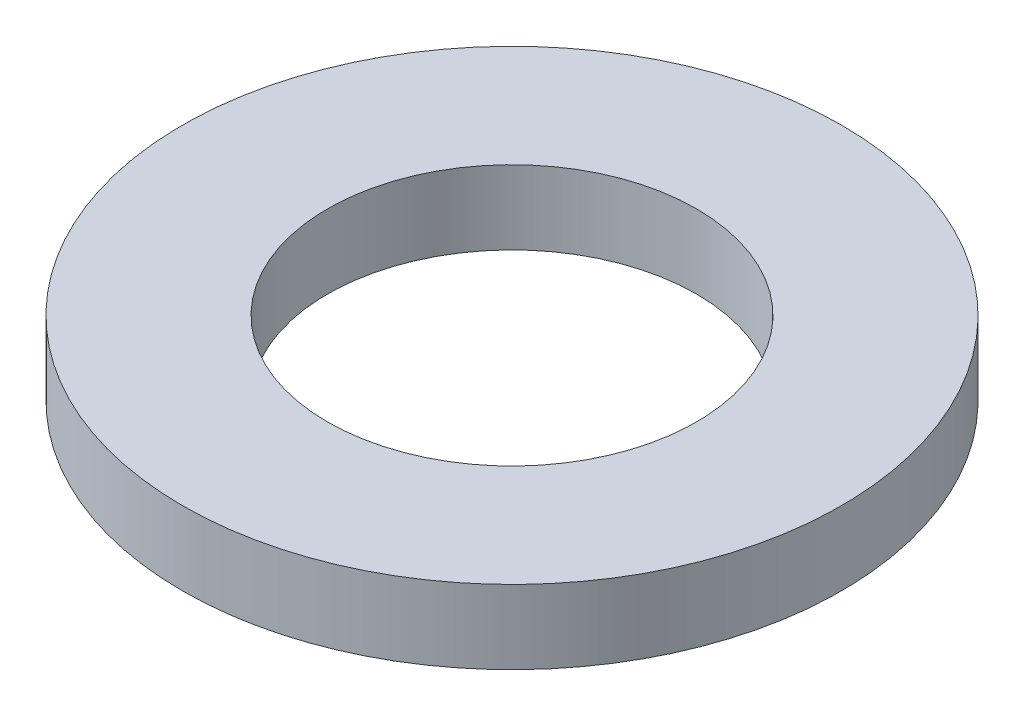
from build123d import *

# Parameters (mm, degrees)
SKETCH1_R           = 62.5
BOSS_EXTRUDE1_DEPTH = 14
SKETCH2_R           = 35
CUT_EXTRUDE1_DEPTH  = 90.49022293


with BuildPart() as part:
    # Sketch1 → Boss-Extrude1 (new body)
    with BuildSketch(Plane(origin=(0, 0, 0), x_dir=(1, 0, 0), z_dir=(0, 1, 0))):
        Circle(SKETCH1_R)
    extrude(amount=BOSS_EXTRUDE1_DEPTH)

    # Sketch2 → Cut-Extrude1 (cut, through all)
    with BuildSketch(Plane(origin=(0, 0, 0), x_dir=(1, 0, 0), z_dir=(0, 1, 0))):
        Circle(SKETCH2_R)
    extrude(amount=CUT_EXTRUDE1_DEPTH, mode=Mode.SUBTRACT)


solid = part.part
